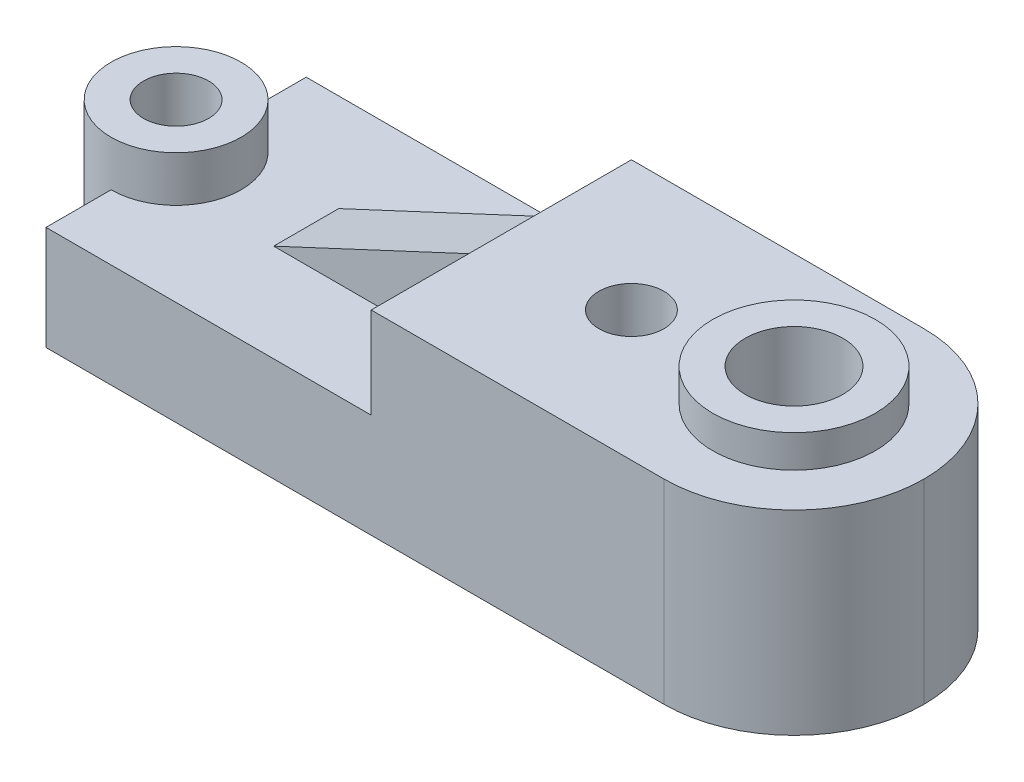
from build123d import *

# Parameters (mm, degrees)
SKETCH1_W               = 115
SKETCH1_H               = 40
BOSS_EXTRUDE1_DEPTH     = 16
SKETCH2_R               = 10
SKETCH2_R_2             = 5
BOSS_EXTRUDE2_DEPTH     = 23
SKETCH3_R               = 7.5
CUT_EXTRUDE1_DEPTH      = 10
CUT_EXTRUDE2_DEPTH      = 36
CUT_EXTRUDE2_DEPTH_BACK = 24
SKETCH4_R               = 5
SKETCH5_W               = 65
SKETCH5_H               = 40
BOSS_EXTRUDE3_DEPTH     = 14
RIB2_REACH              = 78.526
SKETCH8_WALL_W          = 188.158169364
SKETCH8_WALL_H          = 10
FILLET3_R               = 20
SKETCH10_R              = 12.5
SKETCH10_R_2            = 7.5
BOSS_EXTRUDE4_DEPTH     = 5
SKETCH11_R              = 7.5
CUT_EXTRUDE3_DEPTH      = 77.526139325
SKETCH12_R              = 5
CUT_EXTRUDE4_DEPTH      = 77.526139325
CUT_EXTRUDE5_DEPTH      = 20
CUT_EXTRUDE6_DEPTH      = 8


with BuildPart() as part:
    # Sketch1 → Boss-Extrude1 (new body)
    with BuildSketch(Plane(origin=(0, 0, 0), x_dir=(1, 0, 0), z_dir=(0, 1, 0))):
        Rectangle(SKETCH1_W, SKETCH1_H)
    extrude(amount=BOSS_EXTRUDE1_DEPTH)

    # Sketch2 → Boss-Extrude2 (add)
    with BuildSketch(Plane(origin=(0, 0, 0), x_dir=(1, 0, 0), z_dir=(0, 1, 0))):
        with Locations(Location((-57.5, 0, 0), (0, 0, 270))):
            Circle(SKETCH2_R)
        with Locations(Location((-57.5, 0, 0), (0, 0, 270))):
            Circle(SKETCH2_R_2, mode=Mode.SUBTRACT)
    extrude(amount=BOSS_EXTRUDE2_DEPTH)

    # Sketch3 → Cut-Extrude1 (cut)
    with BuildSketch(Plane(origin=(0, 0, 0), x_dir=(1, 0, 0), z_dir=(0, 1, 0))):
        with Locations(Location((-57.5, 0, 0), (0, 0, 270))):
            Circle(SKETCH3_R)
    extrude(amount=CUT_EXTRUDE1_DEPTH, mode=Mode.SUBTRACT)

    # Sketch4 → Cut-Extrude2 (cut, two sides: drawn at the far end of the back side and taken through both)
    with BuildSketch(Plane(origin=(0, 0, 0), x_dir=(1, 0, 0), z_dir=(0, 1, 0)).offset(-CUT_EXTRUDE2_DEPTH_BACK)):
        with Locations(Location((-57.5, 0, 0), (0, 0, 270))):
            Circle(SKETCH4_R)
    extrude(amount=CUT_EXTRUDE2_DEPTH + CUT_EXTRUDE2_DEPTH_BACK, mode=Mode.SUBTRACT)

    # Sketch5 → Boss-Extrude3 (add)
    with BuildSketch(Plane(origin=(0, 16, 0), x_dir=(1, 0, 0), z_dir=(0, 1, 0))):
        with Locations((25, 0)):
            Rectangle(SKETCH5_W, SKETCH5_H)
    extrude(amount=BOSS_EXTRUDE3_DEPTH)

    # Sketch8 wall → Rib2 (add, up to next)
    with BuildSketch(Plane(origin=(-22.5, 23, 0), x_dir=(0.906183139995, 0.422885465331, 0), z_dir=(-0.422885465331, 0.906183139995, 0)), mode=Mode.PRIVATE) as rib2_sk1:
        Rectangle(SKETCH8_WALL_W, SKETCH8_WALL_H)
    rib2_tool1 = extrude(rib2_sk1.sketch, amount=-RIB2_REACH, mode=Mode.PRIVATE) - part.part
    add(rib2_tool1.solids().sort_by_distance((-22.5, 23, 0))[0])

    # Fillet3
    fillet3_edges = [part.edges().sort_by_distance(p)[0] for p in [
        (57.5, 15, -20),
        (57.5, 15, 20),
    ]]
    fillet(fillet3_edges, radius=FILLET3_R - 0.0001)  # a hair under: the kernel refuses the full size

    # Sketch10 → Boss-Extrude4 (add)
    with BuildSketch(Plane(origin=(0, 30, 0), x_dir=(1, 0, 0), z_dir=(0, 1, 0))):
        with Locations(Location((37.5, 0, 0), (0, 0, 90))):
            Circle(SKETCH10_R)
        with Locations(Location((37.5, 0, 0), (0, 0, 270))):
            Circle(SKETCH10_R_2, mode=Mode.SUBTRACT)
    extrude(amount=BOSS_EXTRUDE4_DEPTH)

    # Sketch11 → Cut-Extrude3 (cut, through all)
    with BuildSketch(Plane(origin=(0, 30, 0), x_dir=(1, 0, 0), z_dir=(0, 1, 0))):
        with Locations(Location((37.5, 0, 0), (0, 0, 270))):
            Circle(SKETCH11_R)
    extrude(amount=-CUT_EXTRUDE3_DEPTH, mode=Mode.SUBTRACT)

    # Sketch12 → Cut-Extrude4 (cut, through all)
    with BuildSketch(Plane(origin=(0, 30, 0), x_dir=(1, 0, 0), z_dir=(0, 1, 0))):
        with Locations(Location((12.5, 0, 0), (0, 0, 270))):
            Circle(SKETCH12_R)
    extrude(amount=-CUT_EXTRUDE4_DEPTH, mode=Mode.SUBTRACT)

    # Sketch13 → Cut-Extrude5 (cut)
    with BuildSketch(Plane(origin=(0, 0, 0), x_dir=(1, 0, 0), z_dir=(0, 1, 0))):
        with BuildLine():
            Line((37.5, -15), (-1.5, -15))
            Line((-1.5, -15), (-1.5, 15))
            Line((-1.5, 15), (37.5, 15))
            ThreePointArc((37.5, 15), (52.5, 0), (37.5, -15))
        make_face()
    extrude(amount=CUT_EXTRUDE5_DEPTH, mode=Mode.SUBTRACT)

    # Sketch14 → Cut-Extrude6 (cut)
    with BuildSketch(Plane(origin=(0, 0, 0), x_dir=(1, 0, 0), z_dir=(0, 1, 0))):
        with BuildLine():
            Line((-22.5, 10), (-1.5, 10))
            Line((-1.5, 10), (-1.5, -10))
            Line((-1.5, -10), (-22.5, -10))
            ThreePointArc((-22.5, -10), (-32.5, 0), (-22.5, 10))
        make_face()
    extrude(amount=CUT_EXTRUDE6_DEPTH, mode=Mode.SUBTRACT)


solid = part.part
